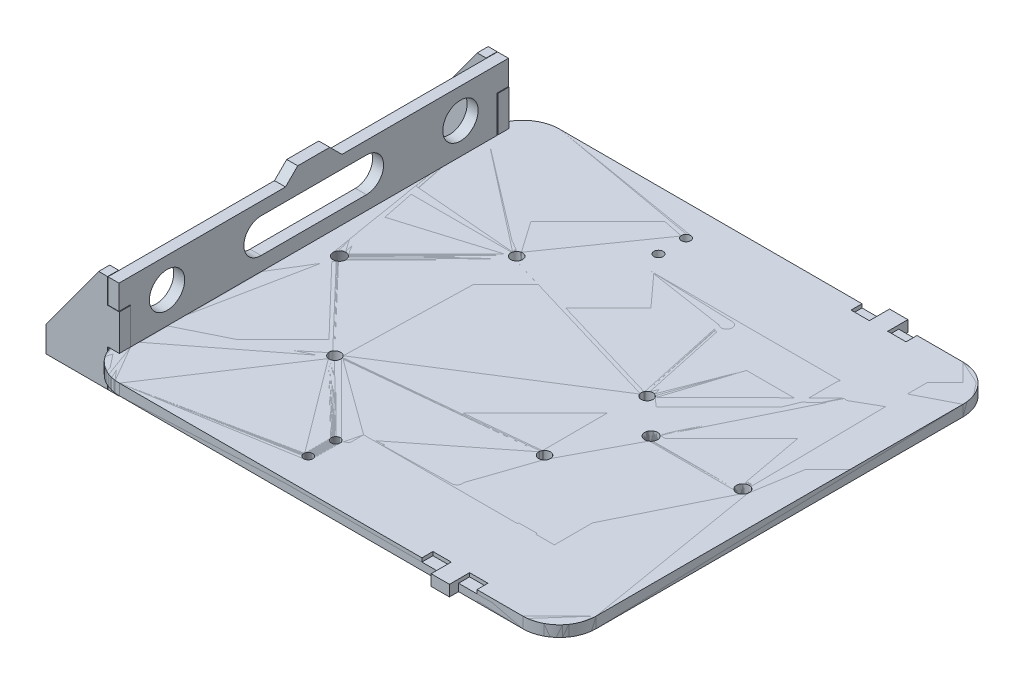
from build123d import *

# Parameters (mm, degrees)
SKETCH1_W                      = 130
SKETCH1_H                      = 120
BOSS_EXTRUDE1_DEPTH            = 3
SKETCH2_R                      = 1.25
CUT_EXTRUDE1_DEPTH             = 89.509886453
FILLET1_R                      = 10
SKETCH3_R                      = 1.6
CUT_EXTRUDE2_DEPTH             = 89.509886453
SKETCH5_R                      = 1.75
CUT_EXTRUDE3_DEPTH             = 10
SKETCH6_W                      = 5
SKETCH6_H                      = 2.5
BOSS_EXTRUDE2_DEPTH            = 3
SKETCH10_R                     = 1.75
SKETCH10_R_2                   = 1.25
SKETCH10_R_3                   = 1.6
BASE_FLANGE1_DEPTH             = 3
SKETCH15_W                     = 3
SKETCH15_H                     = 100
BASE_FLANGE2_DEPTH             = 20
TAB_START                      = -65
TAB_AND_SLOT_TAB1_OUTLINE_W    = 10
TAB_AND_SLOT_TAB1_OUTLINE_H    = 10
TAB_AND_SLOT_TAB1_DEPTH        = 3
TAB_AND_SLOT_SLOT1_OUTLINE_W   = 3
TAB_AND_SLOT_SLOT1_OUTLINE_H   = 10.2
TAB_AND_SLOT_SLOT1_DEPTH       = 3.1
SKETCH18_R                     = 4.817171062
CUT_EXTRUDE4_DEPTH             = 10
SKETCH19_W                     = 20
SKETCH19_H                     = 3
BASE_FLANGE3_DEPTH             = 20
BASE_FLANGE4_DEPTH             = 20
BASE_FLANGE4_DEPTH_BACK        = 1
SKETCH24_W                     = 20
SKETCH24_H                     = 3
MOVE_START                     = -81.9
MOVE_FACE1_OUTLINE_W           = 10
MOVE_FACE1_OUTLINE_H           = 3
MOVE_FACE1_DEPTH               = 20
MOVE_FACE1_2_OUTLINE_W         = 10
MOVE_FACE1_2_OUTLINE_H         = 3
MOVE_FACE1_2_DEPTH             = 20
TAB_START_2                    = 50.1
TAB_AND_SLOT_TAB4_OUTLINE_W    = 20
TAB_AND_SLOT_TAB4_OUTLINE_H    = 9
TAB_AND_SLOT_TAB4_DEPTH        = 3
TAB_START_3                    = -53.1
TAB_AND_SLOT_TAB4_2_OUTLINE_W  = 20
TAB_AND_SLOT_TAB4_2_OUTLINE_H  = 10
TAB_AND_SLOT_TAB4_2_DEPTH      = 3
TAB_START_4                    = -7
TAB_AND_SLOT_TAB4_3_OUTLINE_W  = 3
TAB_AND_SLOT_TAB4_3_OUTLINE_H  = 3.1
TAB_AND_SLOT_TAB4_3_DEPTH      = 10
TAB_START_5                    = 13
TAB_AND_SLOT_TAB4_4_OUTLINE_W  = 3
TAB_AND_SLOT_TAB4_4_OUTLINE_H  = 3.1
TAB_AND_SLOT_TAB4_4_DEPTH      = 10
TAB_AND_SLOT_SLOT4_OUTLINE_W   = 3.2
TAB_AND_SLOT_SLOT4_OUTLINE_H   = 3
TAB_AND_SLOT_SLOT4_DEPTH       = 10.1
TAB_START_6                    = 12.9
TAB_AND_SLOT_SLOT4_2_OUTLINE_W = 3.2
TAB_AND_SLOT_SLOT4_2_OUTLINE_H = 3
TAB_AND_SLOT_SLOT4_2_DEPTH     = 10.1
TAB_AND_SLOT_TAB5_OUTLINE_W    = 3
TAB_AND_SLOT_TAB5_OUTLINE_H    = 3.1
TAB_AND_SLOT_TAB5_DEPTH        = 10
TAB_AND_SLOT_TAB5_2_OUTLINE_W  = 3
TAB_AND_SLOT_TAB5_2_OUTLINE_H  = 3.1
TAB_AND_SLOT_TAB5_2_DEPTH      = 10
TAB_AND_SLOT_SLOT5_OUTLINE_W   = 3.2
TAB_AND_SLOT_SLOT5_OUTLINE_H   = 3
TAB_AND_SLOT_SLOT5_DEPTH       = 10.1
TAB_AND_SLOT_SLOT5_2_OUTLINE_W = 3.2
TAB_AND_SLOT_SLOT5_2_OUTLINE_H = 3
TAB_AND_SLOT_SLOT5_2_DEPTH     = 10.1
CUT_EXTRUDE6_DEPTH             = 144.526896434
SKETCH49_W                     = 38.733430374
SKETCH49_H                     = 3.332331017
CUT_EXTRUDE7_DEPTH             = 46
CHAMFER1_SIZE                  = 10
SKETCH50_W                     = 64.5
SKETCH50_H                     = 21.1
CUT_EXTRUDE9_DEPTH             = 1
SKETCH52_W                     = 64.5
SKETCH52_H                     = 21.1
CUT_EXTRUDE10_DEPTH            = 1
SKETCH54_R                     = 1.5
CUT_EXTRUDE11_DEPTH            = 3
SKETCH55_R                     = 1.5
CUT_EXTRUDE12_DEPTH            = 3


# Read off the part's stored shape, not the designer's step: Tab and Slot-Tab1, Tab and Slot-Slot1, Move Face1, Tab and Slot-Tab4, Tab and Slot-Slot4, Tab and Slot-Tab5, Tab and Slot-Slot5
# Sheet-metal steps are written as plain solids
with BuildPart() as part:
    # Sketch1 → Boss-Extrude1 (new body)
    with BuildSketch(Plane(origin=(0, 0, 0), x_dir=(1, 0, 0), z_dir=(0, 1, 0))):
        Rectangle(SKETCH1_W, SKETCH1_H)
    extrude(amount=BOSS_EXTRUDE1_DEPTH)

    # Sketch2 → Cut-Extrude1 (cut, through all)
    with BuildSketch(Plane(origin=(0, 3, 0), x_dir=(1, 0, 0), z_dir=(0, 1, 0))):
        with Locations(Location((-12, 51.5, 0), (0, 0, 270))):
            Circle(SKETCH2_R)
        with Locations(Location((-12, 44, 0), (0, 0, 270))):
            Circle(SKETCH2_R)
        with Locations(Location((-12, -44, 0), (0, 0, 90))):
            Circle(SKETCH2_R)
        with Locations(Location((-12, -51.5, 0), (0, 0, 90))):
            Circle(SKETCH2_R)
        Polygon((27.5, 67), (42.5, 67), (42.5, 57), (37.5, 57), (37.5, 62), (32.5, 62), (32.5, 57), (27.5, 57), align=None)
        Polygon((37.5, 38.5), (42.5, 38.5), (42.5, 28.5), (27.5, 28.5), (27.5, 38.5), (32.5, 38.5), (32.5, 33.5), (37.5, 33.5), align=None)
        Polygon((27.5, -28.5), (42.5, -28.5), (42.5, -38.5), (37.5, -38.5), (37.5, -33.5), (32.5, -33.5), (32.5, -38.5), (27.5, -38.5), align=None)
        Polygon((37.5, -57), (42.5, -57), (42.5, -67), (27.5, -67), (27.5, -57), (32.5, -57), (32.5, -62), (37.5, -62), align=None)
    extrude(amount=-CUT_EXTRUDE1_DEPTH, mode=Mode.SUBTRACT)

    # Fillet1
    fillet1_edges = [part.edges().sort_by_distance(p)[0] for p in [
        (-65, 1.5, 60),
        (65, 1.5, 60),
        (65, 1.5, -60),
        (-65, 1.5, -60),
    ]]
    fillet(fillet1_edges, radius=FILLET1_R)

    # Sketch3 → Cut-Extrude2 (cut, through all)
    with BuildSketch(Plane(origin=(0, 3, 0), x_dir=(1, 0, 0), z_dir=(0, 1, 0))):
        with Locations(Location((-32.1, -24.13, 0), (0, 0, 270))):
            Circle(SKETCH3_R)
        with Locations(Location((-30.8, 24.13, 0), (0, 0, 270))):
            Circle(SKETCH3_R)
        with Locations(Location((20, -19.05, 0), (0, 0, 270))):
            Circle(SKETCH3_R)
        with Locations(Location((20, 8.89, 0), (0, 0, 270))):
            Circle(SKETCH3_R)
    extrude(amount=-CUT_EXTRUDE2_DEPTH, mode=Mode.SUBTRACT)

    # Sketch5 → Cut-Extrude3 (cut)
    with BuildSketch(Plane(origin=(0, 3, 0), x_dir=(1, 0, 0), z_dir=(0, 1, 0))):
        with Locations(Location((30, 0, 0), (0, 0, 270))):
            Circle(SKETCH5_R)
        with Locations(Location((55, 0, 0), (0, 0, 270))):
            Circle(SKETCH5_R)
        with Locations(Location((-55, 0, 0), (0, 0, 90))):
            Circle(SKETCH5_R)
    extrude(amount=-CUT_EXTRUDE3_DEPTH, mode=Mode.SUBTRACT)

    # Sketch6 → Boss-Extrude2 (add)
    with BuildSketch(Plane(origin=(0, 3, 0), x_dir=(1, 0, 0), z_dir=(0, 1, 0))):
        with Locations((35, 61.25)):
            Rectangle(SKETCH6_W, SKETCH6_H)
        with Locations((35, -61.25)):
            Rectangle(SKETCH6_W, SKETCH6_H)
    extrude(amount=-BOSS_EXTRUDE2_DEPTH)


with BuildPart() as body_2:
    # Sketch10 → Base-Flange1 (new body)
    with BuildSketch(Plane(origin=(0, 3, 0), x_dir=(1, 0, 0), z_dir=(0, 1, 0))):
        with BuildLine():
            Line((55, 60), (-55, 60))
            ThreePointArc((-55, 60), (-62.071067812, 57.071067812), (-65, 50))
            Line((-65, 50), (-65, -50))
            ThreePointArc((-65, -50), (-62.071067812, -57.071067812), (-55, -60))
            Line((-55, -60), (55, -60))
            ThreePointArc((55, -60), (62.071067812, -57.071067812), (65, -50))
            Line((65, -50), (65, 50))
            ThreePointArc((65, 50), (62.071067812, 57.071067812), (55, 60))
        make_face()
        with Locations(Location((55, 0, 0), (0, 0, 270))):
            Circle(SKETCH10_R, mode=Mode.SUBTRACT)
        with Locations(Location((-12, 51.5, 0), (0, 0, 270))):
            Circle(SKETCH10_R_2, mode=Mode.SUBTRACT)
        with Locations(Location((-12, 44, 0), (0, 0, 270))):
            Circle(SKETCH10_R_2, mode=Mode.SUBTRACT)
        with Locations(Location((-30.8, 24.13, 0), (0, 0, 270))):
            Circle(SKETCH10_R_3, mode=Mode.SUBTRACT)
        with Locations(Location((-55, 0, 0), (0, 0, 270))):
            Circle(SKETCH10_R, mode=Mode.SUBTRACT)
        with Locations(Location((20, 8.89, 0), (0, 0, 270))):
            Circle(SKETCH10_R_3, mode=Mode.SUBTRACT)
        with Locations(Location((30, 0, 0), (0, 0, 270))):
            Circle(SKETCH10_R, mode=Mode.SUBTRACT)
        with Locations(Location((20, -19.05, 0), (0, 0, 270))):
            Circle(SKETCH10_R_3, mode=Mode.SUBTRACT)
        with Locations(Location((-12, -51.5, 0), (0, 0, 270))):
            Circle(SKETCH10_R_2, mode=Mode.SUBTRACT)
        with Locations(Location((-12, -44, 0), (0, 0, 270))):
            Circle(SKETCH10_R_2, mode=Mode.SUBTRACT)
        with Locations(Location((-32.1, -24.13, 0), (0, 0, 270))):
            Circle(SKETCH10_R_3, mode=Mode.SUBTRACT)
    extrude(amount=-BASE_FLANGE1_DEPTH)

    # Tab and Slot-Slot1 outline → Tab and Slot-Slot1 (cut)
    with BuildSketch(Plane.YZ.offset(TAB_START)):
        with Locations((1.5, 45)):
            Rectangle(TAB_AND_SLOT_SLOT1_OUTLINE_W, TAB_AND_SLOT_SLOT1_OUTLINE_H)
        with Locations((1.5, 32.142857143)):
            Rectangle(TAB_AND_SLOT_SLOT1_OUTLINE_W, TAB_AND_SLOT_SLOT1_OUTLINE_H)
        with Locations((1.5, 19.285714286)):
            Rectangle(TAB_AND_SLOT_SLOT1_OUTLINE_W, TAB_AND_SLOT_SLOT1_OUTLINE_H)
        with Locations((1.5, 6.428571429)):
            Rectangle(TAB_AND_SLOT_SLOT1_OUTLINE_W, TAB_AND_SLOT_SLOT1_OUTLINE_H)
        with Locations((1.5, -6.428571429)):
            Rectangle(TAB_AND_SLOT_SLOT1_OUTLINE_W, TAB_AND_SLOT_SLOT1_OUTLINE_H)
        with Locations((1.5, -19.285714286)):
            Rectangle(TAB_AND_SLOT_SLOT1_OUTLINE_W, TAB_AND_SLOT_SLOT1_OUTLINE_H)
        with Locations((1.5, -32.142857143)):
            Rectangle(TAB_AND_SLOT_SLOT1_OUTLINE_W, TAB_AND_SLOT_SLOT1_OUTLINE_H)
        with Locations((1.5, -45)):
            Rectangle(TAB_AND_SLOT_SLOT1_OUTLINE_W, TAB_AND_SLOT_SLOT1_OUTLINE_H)
    extrude(amount=TAB_AND_SLOT_SLOT1_DEPTH, mode=Mode.SUBTRACT)

    # Sketch50 → Cut-Extrude9 (cut)
    with BuildSketch(Plane(origin=(0, 3, 0), x_dir=(1, 0, 0), z_dir=(0, 1, 0))):
        with Locations((22.75, -49.45)):
            Rectangle(SKETCH50_W, SKETCH50_H)
    extrude(amount=-CUT_EXTRUDE9_DEPTH, mode=Mode.SUBTRACT)

    # Sketch52 → Cut-Extrude10 (cut)
    with BuildSketch(Plane(origin=(0, 3, 0), x_dir=(1, 0, 0), z_dir=(0, 1, 0))):
        with Locations((22.75, 49.45)):
            Rectangle(SKETCH52_W, SKETCH52_H)
    extrude(amount=-CUT_EXTRUDE10_DEPTH, mode=Mode.SUBTRACT)

    # Sketch54 → Cut-Extrude11 (cut)
    with BuildSketch(Plane(origin=(0, 3, 0), x_dir=(1, 0, 0), z_dir=(0, 1, 0))):
        with Locations(Location((14, -36.926177879, 0), (0, 0, 270))):
            Circle(SKETCH54_R)
        with Locations(Location((48, -36.926177879, 0), (0, 0, 270))):
            Circle(SKETCH54_R)
    extrude(amount=-CUT_EXTRUDE11_DEPTH, mode=Mode.SUBTRACT)

    # Sketch55 → Cut-Extrude12 (cut)
    with BuildSketch(Plane(origin=(0, 3, 0), x_dir=(1, 0, 0), z_dir=(0, 1, 0))):
        with Locations(Location((48, 36.603678508, 0), (0, 0, 270))):
            Circle(SKETCH55_R)
        with Locations(Location((14, 36.603678508, 0), (0, 0, 270))):
            Circle(SKETCH55_R)
    extrude(amount=-CUT_EXTRUDE12_DEPTH, mode=Mode.SUBTRACT)


with BuildPart() as body_3:
    # Sketch15 → Base-Flange2 (new body)
    with BuildSketch(Plane(origin=(0, 3, 0), x_dir=(1, 0, 0), z_dir=(0, 1, 0))):
        with Locations((-63.5, 0)):
            Rectangle(SKETCH15_W, SKETCH15_H)
    extrude(amount=BASE_FLANGE2_DEPTH)

    # Tab and Slot-Tab1 outline → Tab and Slot-Tab1 (add)
    with BuildSketch(Plane.YZ.offset(TAB_START)):
        with Locations((-2, 45)):
            Rectangle(TAB_AND_SLOT_TAB1_OUTLINE_W, TAB_AND_SLOT_TAB1_OUTLINE_H)
        with Locations((-2, -45)):
            Rectangle(TAB_AND_SLOT_TAB1_OUTLINE_W, TAB_AND_SLOT_TAB1_OUTLINE_H)
        with Locations((-2, -32.142857143)):
            Rectangle(TAB_AND_SLOT_TAB1_OUTLINE_W, TAB_AND_SLOT_TAB1_OUTLINE_H)
        with Locations((-2, -19.285714286)):
            Rectangle(TAB_AND_SLOT_TAB1_OUTLINE_W, TAB_AND_SLOT_TAB1_OUTLINE_H)
        with Locations((-2, -6.428571429)):
            Rectangle(TAB_AND_SLOT_TAB1_OUTLINE_W, TAB_AND_SLOT_TAB1_OUTLINE_H)
        with Locations((-2, 6.428571429)):
            Rectangle(TAB_AND_SLOT_TAB1_OUTLINE_W, TAB_AND_SLOT_TAB1_OUTLINE_H)
        with Locations((-2, 19.285714286)):
            Rectangle(TAB_AND_SLOT_TAB1_OUTLINE_W, TAB_AND_SLOT_TAB1_OUTLINE_H)
        with Locations((-2, 32.142857143)):
            Rectangle(TAB_AND_SLOT_TAB1_OUTLINE_W, TAB_AND_SLOT_TAB1_OUTLINE_H)
    extrude(amount=TAB_AND_SLOT_TAB1_DEPTH)

    # Sketch18 → Cut-Extrude4 (cut)
    with BuildSketch(Plane.ZY.offset(65)):
        with Locations((-40, 11.5)):
            Circle(SKETCH18_R)
        with Locations(Location((40, 11.5, 0), (0, 0, 180))):
            Circle(SKETCH18_R)
        with BuildLine():
            Line((-14.366569626, 16.181962423), (14.366569626, 16.181962423))
            ThreePointArc((14.366569626, 16.181962423), (19.048532049, 11.5), (14.366569626, 6.818037577))
            Line((14.366569626, 6.818037577), (-14.366569626, 6.818037577))
            ThreePointArc((-14.366569626, 6.818037577), (-19.048532049, 11.5), (-14.366569626, 16.181962423))
        make_face()
    extrude(amount=-CUT_EXTRUDE4_DEPTH, mode=Mode.SUBTRACT)

    # Tab and Slot-Tab4 3 outline → Tab and Slot-Tab4 3 (add)
    with BuildSketch(Plane(origin=(0, 0, 0), x_dir=(1, 0, 0), z_dir=(0, 1, 0)).offset(TAB_START_4)):
        with Locations((-63.5, 51.55)):
            Rectangle(TAB_AND_SLOT_TAB4_3_OUTLINE_W, TAB_AND_SLOT_TAB4_3_OUTLINE_H)
    extrude(amount=TAB_AND_SLOT_TAB4_3_DEPTH)

    # Tab and Slot-Tab4 4 outline → Tab and Slot-Tab4 4 (add)
    with BuildSketch(Plane(origin=(0, 0, 0), x_dir=(1, 0, 0), z_dir=(0, 1, 0)).offset(TAB_START_5)):
        with Locations((-63.5, 51.55)):
            Rectangle(TAB_AND_SLOT_TAB4_4_OUTLINE_W, TAB_AND_SLOT_TAB4_4_OUTLINE_H)
    extrude(amount=TAB_AND_SLOT_TAB4_4_DEPTH)

    # Tab and Slot-Tab5 outline → Tab and Slot-Tab5 (add)
    with BuildSketch(Plane(origin=(0, 0, 0), x_dir=(1, 0, 0), z_dir=(0, 1, 0)).offset(TAB_START_4)):
        with Locations((-63.5, -51.55)):
            Rectangle(TAB_AND_SLOT_TAB5_OUTLINE_W, TAB_AND_SLOT_TAB5_OUTLINE_H)
    extrude(amount=TAB_AND_SLOT_TAB5_DEPTH)

    # Tab and Slot-Tab5 2 outline → Tab and Slot-Tab5 2 (add)
    with BuildSketch(Plane(origin=(0, 0, 0), x_dir=(1, 0, 0), z_dir=(0, 1, 0)).offset(TAB_START_5)):
        with Locations((-63.5, -51.55)):
            Rectangle(TAB_AND_SLOT_TAB5_2_OUTLINE_W, TAB_AND_SLOT_TAB5_2_OUTLINE_H)
    extrude(amount=TAB_AND_SLOT_TAB5_2_DEPTH)


with BuildPart() as body_4:
    # Sketch19 → Base-Flange3 (new body)
    with BuildSketch(Plane(origin=(0, 3, 0), x_dir=(1, 0, 0), z_dir=(0, 1, 0))):
        with Locations((-71.9, 51.6)):
            Rectangle(SKETCH19_W, SKETCH19_H)
    extrude(amount=BASE_FLANGE3_DEPTH)

    # Move Face1 outline → Move Face1 (cut)
    with BuildSketch(Plane.YZ.offset(MOVE_START)):
        with Locations((18, -51.6)):
            Rectangle(MOVE_FACE1_OUTLINE_W, MOVE_FACE1_OUTLINE_H)
    extrude(amount=MOVE_FACE1_DEPTH, mode=Mode.SUBTRACT)

    # Move Face1 2 outline → Move Face1 2 (add)
    with BuildSketch(Plane.YZ.offset(MOVE_START)):
        with Locations((-2, -51.6)):
            Rectangle(MOVE_FACE1_2_OUTLINE_W, MOVE_FACE1_2_OUTLINE_H)
    extrude(amount=MOVE_FACE1_2_DEPTH)

    # Tab and Slot-Tab4 2 outline → Tab and Slot-Tab4 2 (add)
    with BuildSketch(Plane.XY.offset(TAB_START_3)):
        with Locations((-71.9, 18)):
            Rectangle(TAB_AND_SLOT_TAB4_2_OUTLINE_W, TAB_AND_SLOT_TAB4_2_OUTLINE_H)
    extrude(amount=TAB_AND_SLOT_TAB4_2_DEPTH)

    # Tab and Slot-Slot4 outline → Tab and Slot-Slot4 (cut)
    with BuildSketch(Plane(origin=(0, 0, 0), x_dir=(1, 0, 0), z_dir=(0, 1, 0)).offset(TAB_START_4)):
        with Locations((-63.5, 51.6)):
            Rectangle(TAB_AND_SLOT_SLOT4_OUTLINE_W, TAB_AND_SLOT_SLOT4_OUTLINE_H)
    extrude(amount=TAB_AND_SLOT_SLOT4_DEPTH, mode=Mode.SUBTRACT)

    # Tab and Slot-Slot4 2 outline → Tab and Slot-Slot4 2 (cut)
    with BuildSketch(Plane(origin=(0, 0, 0), x_dir=(1, 0, 0), z_dir=(0, 1, 0)).offset(TAB_START_6)):
        with Locations((-63.5, 51.6)):
            Rectangle(TAB_AND_SLOT_SLOT4_2_OUTLINE_W, TAB_AND_SLOT_SLOT4_2_OUTLINE_H)
    extrude(amount=TAB_AND_SLOT_SLOT4_2_DEPTH, mode=Mode.SUBTRACT)


with BuildPart() as body_5:
    # Sketch24 → Base-Flange4 (new, two sides: drawn at the far end of the back side and taken through both)
    with BuildSketch(Plane(origin=(0, 3, 0), x_dir=(1, 0, 0), z_dir=(0, 1, 0)).offset(-BASE_FLANGE4_DEPTH_BACK)):
        with Locations((-71.9, -51.6)):
            Rectangle(SKETCH24_W, SKETCH24_H)
    extrude(amount=BASE_FLANGE4_DEPTH + BASE_FLANGE4_DEPTH_BACK)

    # Tab and Slot-Tab4 outline → Tab and Slot-Tab4 (add)
    with BuildSketch(Plane.XY.offset(TAB_START_2)):
        with Locations((-71.9, -2.5)):
            Rectangle(TAB_AND_SLOT_TAB4_OUTLINE_W, TAB_AND_SLOT_TAB4_OUTLINE_H)
    extrude(amount=TAB_AND_SLOT_TAB4_DEPTH)

    # Tab and Slot-Slot5 outline → Tab and Slot-Slot5 (cut)
    with BuildSketch(Plane(origin=(0, 0, 0), x_dir=(1, 0, 0), z_dir=(0, 1, 0)).offset(TAB_START_4)):
        with Locations((-63.5, -51.6)):
            Rectangle(TAB_AND_SLOT_SLOT5_OUTLINE_W, TAB_AND_SLOT_SLOT5_OUTLINE_H)
    extrude(amount=TAB_AND_SLOT_SLOT5_DEPTH, mode=Mode.SUBTRACT)

    # Tab and Slot-Slot5 2 outline → Tab and Slot-Slot5 2 (cut)
    with BuildSketch(Plane(origin=(0, 0, 0), x_dir=(1, 0, 0), z_dir=(0, 1, 0)).offset(TAB_START_6)):
        with Locations((-63.5, -51.6)):
            Rectangle(TAB_AND_SLOT_SLOT5_2_OUTLINE_W, TAB_AND_SLOT_SLOT5_2_OUTLINE_H)
    extrude(amount=TAB_AND_SLOT_SLOT5_2_DEPTH, mode=Mode.SUBTRACT)


with BuildPart() as cut_extrude6_tool:
    # Sketch48 → Cut-Extrude6 (new, through all)
    with BuildSketch(Plane.XY.offset(53.1)):
        Polygon((-65.1, 23), (-81.9, 0), (-81.9, -7), (-91.059006771, -7), (-91.059006771, 23), align=None)
    extrude(amount=-CUT_EXTRUDE6_DEPTH)


with BuildPart() as body_4_1:
    add(body_4.part)

    # Cut-Extrude6: cut by cut_extrude6_tool
    add(cut_extrude6_tool.part, mode=Mode.SUBTRACT)


with BuildPart() as body_5_1:
    add(body_5.part)

    # Cut-Extrude6: cut by cut_extrude6_tool
    add(cut_extrude6_tool.part, mode=Mode.SUBTRACT)


with BuildPart() as cut_extrude7_tool:
    # Sketch49 → Cut-Extrude7 (new body)
    with BuildSketch(Plane(origin=(-62, 0, 0), x_dir=(0, 0, -1), z_dir=(1, 0, 0))):
        with Locations((33.733284813, 21.333834491)):
            Rectangle(SKETCH49_W, SKETCH49_H)
        with Locations((-33.733284813, 21.333834491)):
            Rectangle(SKETCH49_W, SKETCH49_H)
    extrude(amount=-CUT_EXTRUDE7_DEPTH)


with BuildPart() as body_3_1:
    add(body_3.part)

    # Cut-Extrude7: cut by cut_extrude7_tool
    add(cut_extrude7_tool.part, mode=Mode.SUBTRACT)

    # Chamfer1
    # the kernel refuses this chamfer: 10 mm, written as the material it takes off along each edge
    with BuildSketch(Plane(origin=(-36.28317012, 23, -14.366569626), x_dir=(0, 0.027495876610586317, 0.9996219169112968), z_dir=(-1, 0, 0))) as chamfer1_piece_1_section:
        Polygon((CHAMFER1_SIZE * 0.999621916911, -CHAMFER1_SIZE * 0.0274958766106), (-CHAMFER1_SIZE * 0.0274958766106, -CHAMFER1_SIZE * 0.999621916911), (0, 0), align=None)
    chamfer1_piece_1 = extrude(amount=54.433659759, mode=Mode.PRIVATE)
    chamfer1_piece_1 = split(chamfer1_piece_1, bisect_by=Plane(origin=(-63.5, 19.667668983, -10.07927053), z_dir=(0, 1, 0)), keep=Keep.TOP, mode=Mode.PRIVATE)
    add(chamfer1_piece_1, mode=Mode.SUBTRACT)
    with BuildSketch(Plane(origin=(-36.28317012, 23, 14.366569626), x_dir=(0, -0.9996219169112968, 0.027495876610586317), z_dir=(-1, 0, 0))) as chamfer1_piece_2_section:
        Polygon((CHAMFER1_SIZE * 0.999621916911, -CHAMFER1_SIZE * 0.0274958766106), (-CHAMFER1_SIZE * 0.0274958766106, -CHAMFER1_SIZE * 0.999621916911), (0, 0), align=None)
    chamfer1_piece_2 = extrude(amount=54.433659759, mode=Mode.PRIVATE)
    chamfer1_piece_2 = split(chamfer1_piece_2, bisect_by=Plane(origin=(-63.5, 19.667668983, 10.07927053), z_dir=(0, 1, 0)), keep=Keep.TOP, mode=Mode.PRIVATE)
    add(chamfer1_piece_2, mode=Mode.SUBTRACT)


with BuildPart() as body_4_2:
    add(body_4_1.part)

    # Cut-Extrude7: cut by cut_extrude7_tool
    add(cut_extrude7_tool.part, mode=Mode.SUBTRACT)


with BuildPart() as body_5_2:
    add(body_5_1.part)

    # Cut-Extrude7: cut by cut_extrude7_tool
    add(cut_extrude7_tool.part, mode=Mode.SUBTRACT)


solid = Compound([part.part, body_2.part, body_3_1.part, body_4_2.part, body_5_2.part])
